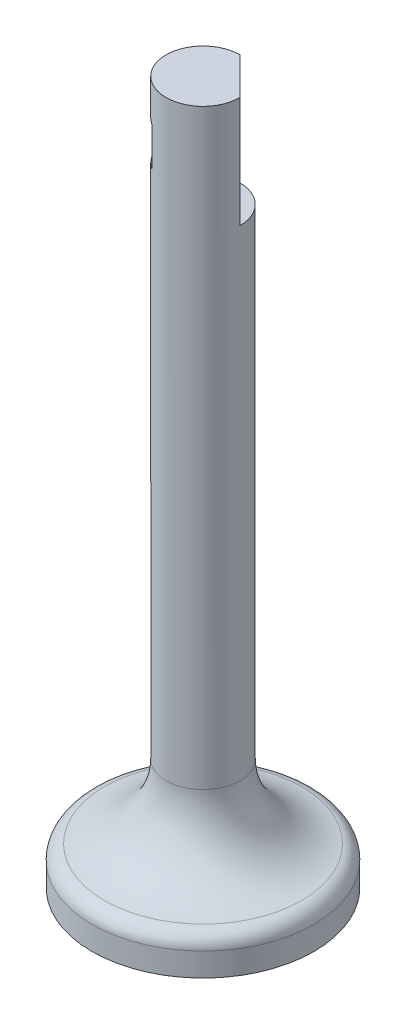
from build123d import *

# Parameters (mm, degrees)
SKETCH1_R           = 15
BOSS_EXTRUDE1_DEPTH = 5
SKETCH2_R           = 5
BOSS_EXTRUDE2_DEPTH = 90
CUT_EXTRUDE1_START  = -15
CUT_EXTRUDE1_DEPTH  = 15
SKETCH4_W           = 2
SKETCH4_H           = 5.2
CUT_EXTRUDE2_DEPTH  = 99.17076958
FILLET1_R           = 10
FILLET2_R           = 2
CUT_EXTRUDE3_DEPTH  = 1
SKETCH6_R           = 13.5
SKETCH6_R_2         = 11.5
CUT_EXTRUDE4_DEPTH  = 1


with BuildPart() as part:
    # Sketch1 → Boss-Extrude1 (new body)
    with BuildSketch(Plane(origin=(0, 0, 0), x_dir=(1, 0, 0), z_dir=(0, 1, 0))):
        with Locations(Location((0, 0, 0), (0, 0, 270))):
            Circle(SKETCH1_R)
    extrude(amount=BOSS_EXTRUDE1_DEPTH)

    # Sketch2 → Boss-Extrude2 (add)
    with BuildSketch(Plane(origin=(0, 5, 0), x_dir=(1, 0, 0), z_dir=(0, 1, 0))):
        with Locations(Location((0, 0, 0), (0, 0, 90))):
            Circle(SKETCH2_R)
    extrude(amount=BOSS_EXTRUDE2_DEPTH)

    # Sketch3 → Cut-Extrude1 (cut)
    with BuildSketch(Plane(origin=(0, 95, 0), x_dir=(1, 0, 0), z_dir=(0, 1, 0)).offset(CUT_EXTRUDE1_START)):
        with BuildLine():
            Line((0, 5), (5, 0))
            ThreePointArc((5, 0), (3.535533906, 3.535533906), (0, 5))
        make_face()
    extrude(amount=CUT_EXTRUDE1_DEPTH, mode=Mode.SUBTRACT)

    # Sketch4 → Cut-Extrude2 (cut, through all)
    with BuildSketch(Plane(origin=(2.5, 0, -2.5), x_dir=(-0.7071067811865475, 0, -0.7071067811865477), z_dir=(0.7071067811865477, 0, -0.7071067811865475))):
        with Locations((0, 87.5)):
            Rectangle(SKETCH4_W, SKETCH4_H)
    extrude(amount=-CUT_EXTRUDE2_DEPTH, mode=Mode.SUBTRACT)

    # Fillet1
    fillet1_edges = [part.edges().sort_by_distance(p)[0] for p in [
        (0, 5, 5),
    ]]
    fillet(fillet1_edges, radius=FILLET1_R - 0.0001)  # a hair under: the kernel refuses the full size

    # Fillet2
    fillet2_edges = [part.edges().sort_by_distance(p)[0] for p in [
        (0, 5, -15),
    ]]
    fillet(fillet2_edges, radius=FILLET2_R)

    # Sketch5 → Cut-Extrude3 (cut)
    with BuildSketch(Plane.XZ):
        Polygon((-5.546534945, 7.181387117), (4.296413773, -2.661561601), (7.972695825, 1.01472045), (9.290003517, -0.302587242), (0.443849671, -9.148741088), (-0.873458021, -7.831433396), (2.818849671, -4.139125704), (-7.024099047, 5.703823014), align=None)
    extrude(amount=-CUT_EXTRUDE3_DEPTH, mode=Mode.SUBTRACT)

    # Sketch6 → Cut-Extrude4 (cut)
    with BuildSketch(Plane.XZ):
        with Locations(Location((0, 0, 0), (0, 0, 270))):
            Circle(SKETCH6_R)
        with Locations(Location((0, 0, 0), (0, 0, 270))):
            Circle(SKETCH6_R_2, mode=Mode.SUBTRACT)
    extrude(amount=-CUT_EXTRUDE4_DEPTH, mode=Mode.SUBTRACT)


solid = part.part
